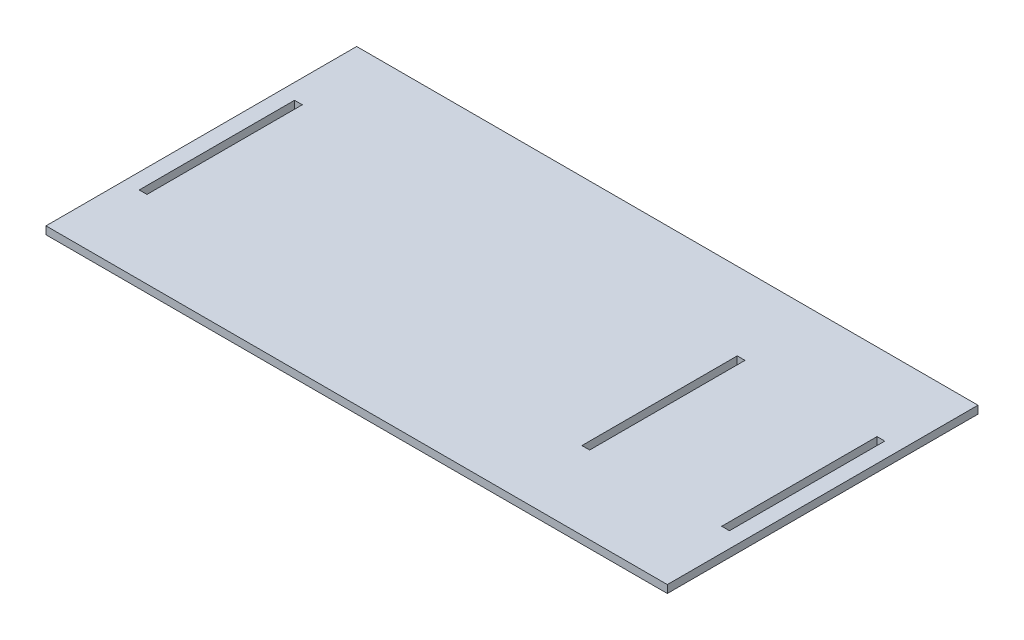
from build123d import *

# Parameters (mm, degrees)
CROQUIS1_W              = 400
CROQUIS1_H              = 200
CROQUIS1_W_2            = 5
CROQUIS1_H_2            = 100
SALIENTE_EXTRUIR1_DEPTH = 5


with BuildPart() as part:
    # Croquis1 → Saliente-Extruir1 (new body)
    with BuildSketch(Plane(origin=(0, 0, 0), x_dir=(1, 0, 0), z_dir=(0, 1, 0))):
        Rectangle(CROQUIS1_W, CROQUIS1_H)
        with Locations((187.5, 0)):
            Rectangle(CROQUIS1_W_2, CROQUIS1_H_2, mode=Mode.SUBTRACT)
        with Locations((-187.5, 0)):
            Rectangle(CROQUIS1_W_2, CROQUIS1_H_2, mode=Mode.SUBTRACT)
        with Locations((97.5, 0)):
            Rectangle(CROQUIS1_W_2, CROQUIS1_H_2, mode=Mode.SUBTRACT)
    extrude(amount=SALIENTE_EXTRUIR1_DEPTH)


solid = part.part
